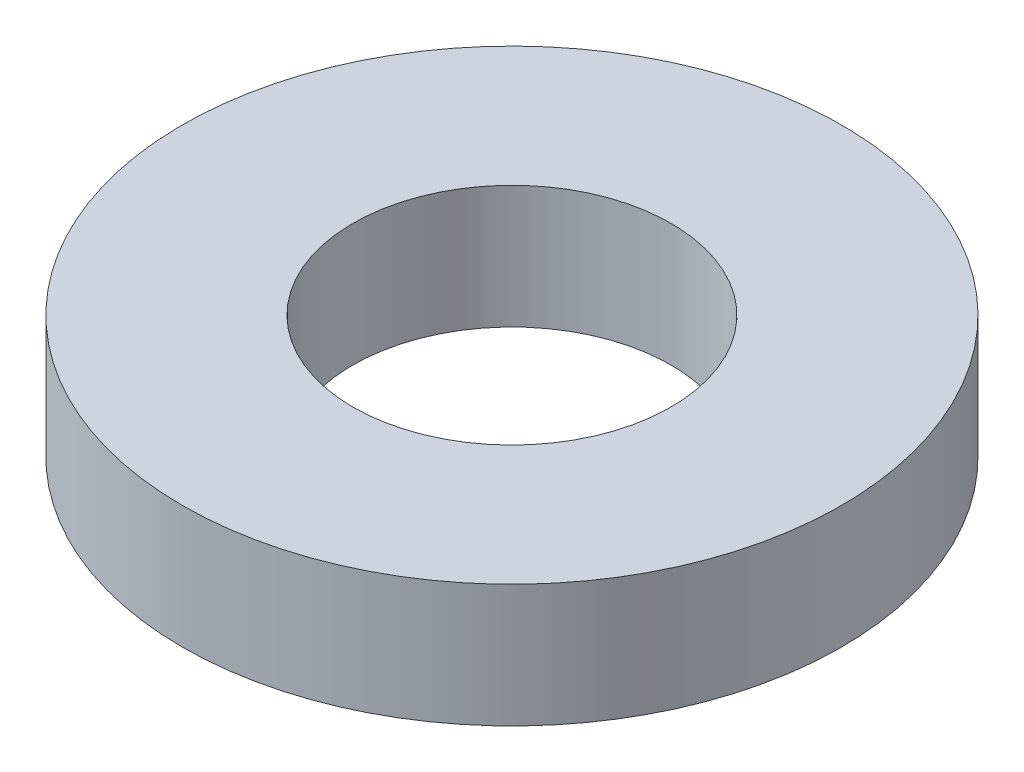
from build123d import *

# Parameters (mm, degrees)
SKETCH1_R           = 72.5
BOSS_EXTRUDE1_DEPTH = 27
SKETCH2_R           = 35
CUT_EXTRUDE1_DEPTH  = 107.025940222


with BuildPart() as part:
    # Sketch1 → Boss-Extrude1 (new body)
    with BuildSketch(Plane(origin=(0, 0, 0), x_dir=(1, 0, 0), z_dir=(0, 1, 0))):
        Circle(SKETCH1_R)
    extrude(amount=BOSS_EXTRUDE1_DEPTH)

    # Sketch2 → Cut-Extrude1 (cut, through all)
    with BuildSketch(Plane(origin=(0, 0, 0), x_dir=(1, 0, 0), z_dir=(0, 1, 0))):
        Circle(SKETCH2_R)
    extrude(amount=CUT_EXTRUDE1_DEPTH, mode=Mode.SUBTRACT)


solid = part.part
